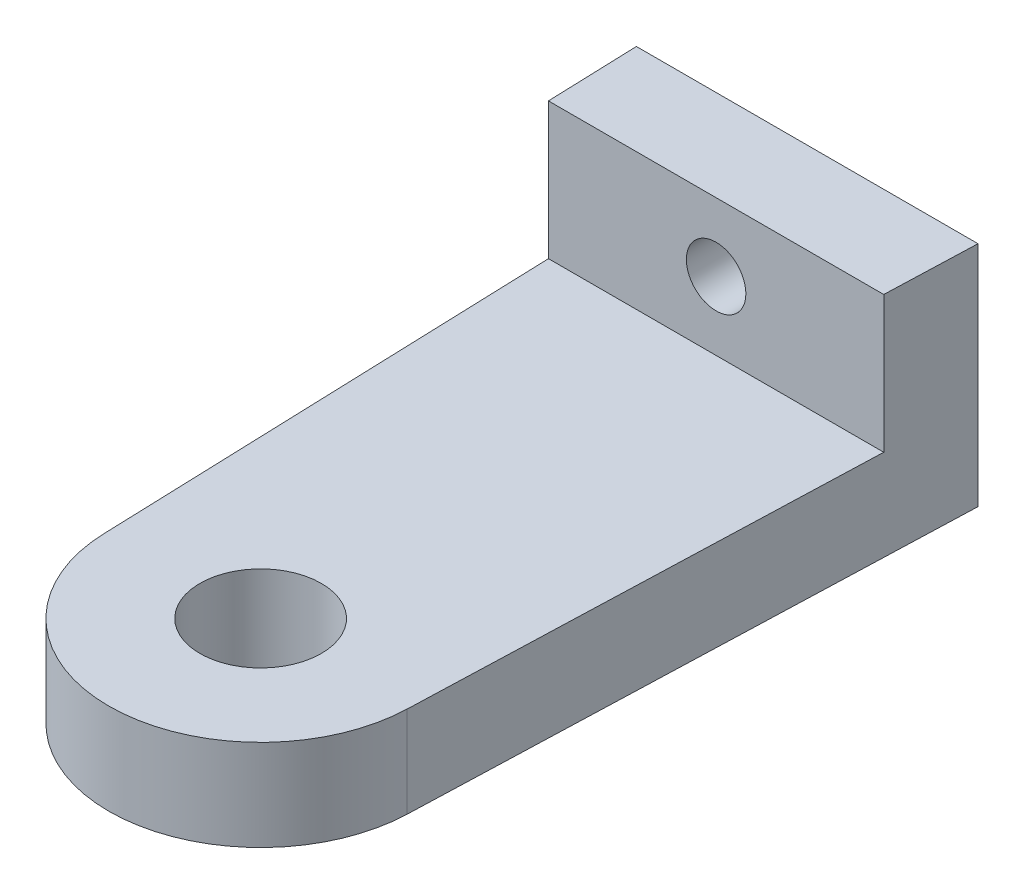
from build123d import *

# Parameters (mm, degrees)
SKETCH2_R                  = 5.08
BOSS_EXTRUDE2_DEPTH        = 3.81
BOSS_EXTRUDE4_DEPTH        = 15.24
F_9_0_196_DIAMETER_HOLE1_D = 4.9784


with BuildPart() as part:
    # Sketch2 → Boss-Extrude2 (new, symmetric)
    with BuildSketch(Plane(origin=(0, 0, 0), x_dir=(-1, 0, 0), z_dir=(0, 1, 0))):
        with BuildLine():
            Line((-14.2875, 0), (14.2875, 0))
            Line((14.2875, 0), (12.692423957, 46.158604709))
            ThreePointArc((12.692423957, 46.158604709), (0, 58.42), (-12.692423957, 46.158604709))
            Line((-12.692423957, 46.158604709), (-14.2875, 0))
        make_face()
        with Locations((0, 45.72)):
            Circle(SKETCH2_R, mode=Mode.SUBTRACT)
    extrude(amount=BOSS_EXTRUDE2_DEPTH, both=True)

    # Sketch2<4> → Boss-Extrude4 (add)
    with BuildSketch(Plane(origin=(0, 0, 0), x_dir=(-1, 0, 0), z_dir=(0, 1, 0))):
        Polygon((-14.024180094, 7.62), (-14.2875, 0), (14.2875, 0), (14.024180094, 7.62), align=None)
    extrude(amount=BOSS_EXTRUDE4_DEPTH)

    # #9 (0.196) Diameter Hole1 (through all)
    with Locations(Plane.XY.offset(7.62)):
        with Locations((0, 9.525)):
            Hole(F_9_0_196_DIAMETER_HOLE1_D / 2)


solid = part.part
